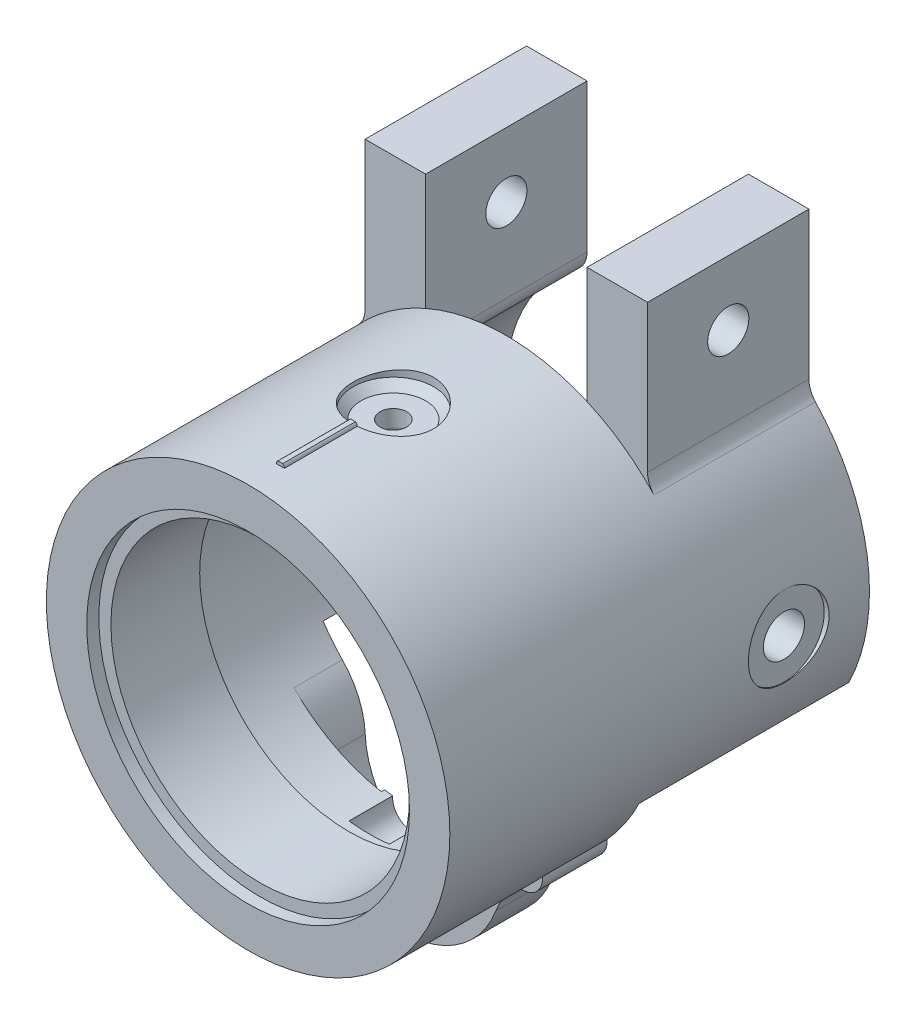
from build123d import *
from build123d.topology import SkipClean

# Parameters (mm, degrees)
SKETCH_1_R               = 25
SKETCH_1_R_2             = 18.5
EXTRUDE_1_DEPTH          = 11
SKETCH_2_R               = 25
SKETCH_2_R_2             = 20
EXTRUDE_2_DEPTH          = 1.5
EXTRUDE_START            = 1.5
SKETCH_3_R               = 25
SKETCH_3_R_2             = 20
EXTRUDE_3_DEPTH          = 1.5
SKETCH_4_R               = 0.5
EXTRUDE_4_DEPTH          = 10
EXTRUDE_START_2          = 4
SKETCH_6_R               = 22
EXTRUDE_5_DEPTH          = 4
SKETCH_7_R               = 2
CUT_EXTRUDE_1_DEPTH      = 4
F_1_ENCODERHOLDER_2_R    = 22
F_1_ENCODERHOLDER_2_R_2  = 18.5
F_1_ENCODERHOLDER_DEPTH  = 4
F_2_ENCODERHOLDER_START  = -4
F_2_ENCODERHOLDER_2_R    = 2
F_2_ENCODERHOLDER_DEPTH  = 4
F_3_ENCODERHOLDER_2_R    = 25
F_3_ENCODERHOLDER_2_R_2  = 18.5
F_3_ENCODERHOLDER_DEPTH  = 4
F_8_ENCODERHOLDER_R      = 2.5
CUT_EXTRUDE_6_DEPTH      = 10
SKETCH_9_R               = 12.5
CUT_EXTRUDE_7_DEPTH      = 2
F_5_ENCODERHOLDER_DEPTH  = 4
EXTRUDE_1_2_DEPTH        = 0.4
FILLET_1_R               = 1
SKETCH_12_R              = 0.9
CUT_EXTRUDE_8_DEPTH      = 10
EXTRUDE_2_2_DEPTH        = 6
FILLET_2_R               = 1
FILLET_START             = -1
FILLET_3_DEPTH           = 5
FILLET_START_2           = 0.675968
FILLET_3_2_DEPTH         = 5.324032
CUT_EXTRUDE_9_DEPTH      = 10
MOVE_BODY_2_ANGLE        = 180
SKETCH_15_R              = 20
CUT_EXTRUDE_10_DEPTH     = 79
EXTRUDE_12_DEPTH         = 4
CUT_EXTRUDE_11_DEPTH     = 3
EXTRUDE_13_DEPTH         = 10
EXTRUDE_14_DEPTH         = 1
SKETCH_22_R              = 1
CUT_EXTRUDE_12_DEPTH     = 8
SKETCH_23_R              = 2.5
SKETCH_23_R_2            = 1
EXTRUDE_16_DEPTH         = 8
SKETCH_24_W              = 1.265565874
SKETCH_24_H              = 0.2
CUT_EXTRUDE_13_DEPTH     = 25
EXTRUDE_5_2_DEPTH        = 6
FILLET_4_R               = 10
FILLET_5_R               = 10
FILLET_6_R               = 10
FILLET_7_R               = 10
SKETCH_26_R              = 1.65
CUT_EXTRUDE_14_DEPTH     = 36
SKETCH_27_R              = 5
CUT_EXTRUDE_15_DEPTH     = 2.4
FILLET_8_R               = 1
CHAMFER_2_SIZE           = 1
EXTRUDE_18_DEPTH         = 24
SKETCH_29_R              = 2.55
CUT_EXTRUDE_16_DEPTH     = 67
SKETCH_30_R              = 5
CUT_EXTRUDE_17_DEPTH     = 1
PATTERN_CIRCULAR_1_COUNT = 4
EXTRUDE_19_DEPTH         = 2
SKETCH_32_W              = 20
SKETCH_32_H              = 27.86164832
CUT_EXTRUDE_18_DEPTH     = 20
SKETCH_33_W              = 7.5
SKETCH_33_H              = 20
EXTRUDE_20_DEPTH         = 20
SKETCH_34_R              = 2.55
CUT_EXTRUDE_19_DEPTH     = 20
FILLET_9_R               = 3


with BuildPart() as part:
    # 草图1 → Extrude 1 (new body)
    with BuildSketch(Plane.XY):
        Circle(SKETCH_1_R)
        Circle(SKETCH_1_R_2, mode=Mode.SUBTRACT)
    extrude(amount=EXTRUDE_1_DEPTH)

    # 草图2 → Extrude 2 (add)
    with BuildSketch(Plane.XY.offset(11)):
        Circle(SKETCH_2_R)
        Circle(SKETCH_2_R_2, mode=Mode.SUBTRACT)
    extrude(amount=EXTRUDE_2_DEPTH)

    # 草图3 → 凸台-拉伸3 (add)
    with BuildSketch(Plane(origin=(0, 0, 0), x_dir=(-1, 0, 0), z_dir=(0, 0, -1)).offset(EXTRUDE_START)):
        Circle(SKETCH_3_R)
        with Locations(Location((0, 0, 0), (0, 0, 180))):
            Circle(SKETCH_3_R_2, mode=Mode.SUBTRACT)
    extrude(amount=-EXTRUDE_3_DEPTH)

    # 草图4 → 凸台-拉伸4 (add)
    with SkipClean():  # the faces are left unmerged after this step: merging them gives an invalid solid
        with BuildSketch(Plane(origin=(0, 0, -1.5), x_dir=(-1, 0, 0), z_dir=(0, 0, -1))):
            with Locations((0, 25)):
                Circle(SKETCH_4_R)
        extrude(amount=-EXTRUDE_4_DEPTH)

    # 草图6 → Extrude 5 (add)
    with SkipClean():  # the faces are left unmerged after this step: merging them gives an invalid solid
        with BuildSketch(Plane(origin=(0, 0, -1.5), x_dir=(-1, 0, 0), z_dir=(0, 0, -1)).offset(EXTRUDE_START_2)):
            with BuildLine():
                ThreePointArc((-0.499974999, 24.995), (0, -25), (0.499974999, 24.995))
                ThreePointArc((0.499974999, 24.995), (0, 25.5), (-0.499974999, 24.995))
            make_face()
            Circle(SKETCH_6_R, mode=Mode.SUBTRACT)
        extrude(amount=-EXTRUDE_5_DEPTH)

    # 草图7 → 切除-拉伸1 (cut)
    with SkipClean():  # the faces are left unmerged after this step: merging them gives an invalid solid
        with BuildSketch(Plane(origin=(0, 0, -5.5), x_dir=(-1, 0, 0), z_dir=(0, 0, -1))):
            with Locations((0, 22)):
                Circle(SKETCH_7_R)
        extrude(amount=-CUT_EXTRUDE_1_DEPTH, mode=Mode.SUBTRACT)


with BuildPart() as body_2:
    # 1_EncoderHolder 2 → 1_EncoderHolder (new body)
    with BuildSketch(Plane.XY):
        Circle(F_1_ENCODERHOLDER_2_R)
        Circle(F_1_ENCODERHOLDER_2_R_2, mode=Mode.SUBTRACT)
    extrude(amount=F_1_ENCODERHOLDER_DEPTH)

    # 2_EncoderHolder 2 → 2_EncoderHolder (add)
    with BuildSketch(Plane.XY.offset(4).offset(F_2_ENCODERHOLDER_START)):
        with Locations((0, 22)):
            Circle(F_2_ENCODERHOLDER_2_R)
    extrude(amount=F_2_ENCODERHOLDER_DEPTH)

    # 3_EncoderHolder 2 → 3_EncoderHolder (add)
    with BuildSketch(Plane.XY.offset(4)):
        with Locations(Location((0, 0, 0), (0, 0, 91.14593469))):
            Circle(F_3_ENCODERHOLDER_2_R)
        Circle(F_3_ENCODERHOLDER_2_R_2, mode=Mode.SUBTRACT)
    extrude(amount=F_3_ENCODERHOLDER_DEPTH)

    # 草图8_EncoderHolder → 切除-拉伸6 (cut)
    with BuildSketch(Plane(origin=(0, 0, 0), x_dir=(-1, 0, 0), z_dir=(0, 0, -1))):
        with Locations((0, -20)):
            Circle(F_8_ENCODERHOLDER_R)
    extrude(amount=-CUT_EXTRUDE_6_DEPTH, mode=Mode.SUBTRACT)

    # 草图9 → 切除-拉伸7 (cut)
    with BuildSketch(Plane.XY.offset(8)):
        with Locations((0, -20)):
            Circle(SKETCH_9_R)
    extrude(amount=-CUT_EXTRUDE_7_DEPTH, mode=Mode.SUBTRACT)

    # 草图10 → 5_EncoderHolder (add)
    with BuildSketch(Plane.XY.offset(8)):
        with BuildLine():
            ThreePointArc((-11.297234175, -14.65), (-12.35555427, -18.105196926), (-12.381272085, -21.71875))
            ThreePointArc((-12.381272085, -21.71875), (0, 25), (12.381272085, -21.71875))
            ThreePointArc((12.381272085, -21.71875), (12.35555427, -18.105196926), (11.297234175, -14.65))
            ThreePointArc((11.297234175, -14.65), (0, 18.5), (-11.297234175, -14.65))
        make_face()
    extrude(amount=F_5_ENCODERHOLDER_DEPTH)

    # 草图11 → Extrude 1 2 (add)
    with BuildSketch(Plane.XY.offset(6)):
        with BuildLine():
            ThreePointArc((-1.920937271, -18.4), (0, -22.5), (1.920937271, -18.4))
            Line((1.920937271, -18.4), (2.68931218, -17.76))
            ThreePointArc((2.68931218, -17.76), (0, -23.5), (-2.68931218, -17.76))
            Line((-2.68931218, -17.76), (-1.920937271, -18.4))
        make_face()
    extrude(amount=EXTRUDE_1_2_DEPTH)

    # 圆角1
    # the kernel refuses this fillet: 1 mm, written as the material it takes off along each edge
    with BuildSketch(Plane(origin=(2.68931218, -17.76, 6), x_dir=(-0.7683749084931953, -0.6399999999984951, 0), z_dir=(0, 0, 1))) as fillet_1_piece_1:
        with BuildLine():
            CenterArc((1.2, 0.979795897), FILLET_1_R, 156.926081935, 101.536959033)
            Line((0.28, 1.371714256), (0.2616, 1.379552623))
            ThreePointArc((0.2616, 1.379552623), (0.051118442, 0.704), (-0.02, 0))
            Line((-0.02, 0), (0, -0.02))
            ThreePointArc((0, -0.02), (0.5, -0.02), (0.996, -0.019595918))
            Line((0.996, -0.019595918), (1, 0))
        make_face()
    extrude(amount=3.9, mode=Mode.SUBTRACT)
    with BuildSketch(Plane(origin=(-2.68931218, -17.76, 6), x_dir=(0.7683749084932087, -0.6399999999984791, 0), z_dir=(0, 0, 1))) as fillet_1_piece_2:
        with BuildLine():
            CenterArc((1.2, -0.979795897), FILLET_1_R, 101.536959033, 101.536959033)
            Line((0.28, -1.371714256), (0.2616, -1.379552623))
            ThreePointArc((0.2616, -1.379552623), (0.051118442, -0.704), (-0.02, 0))
            Line((-0.02, 0), (0, 0.02))
            ThreePointArc((0, 0.02), (0.5, 0.02), (0.996, 0.019595918))
            Line((0.996, 0.019595918), (1, 0))
        make_face()
    extrude(amount=3.9, mode=Mode.SUBTRACT)

    # 草图12 → 切除-拉伸8 (cut)
    with BuildSketch(Plane.XY.offset(12)):
        with Locations((-17.320508076, -10)):
            Circle(SKETCH_12_R)
        with Locations((17.320508076, -10)):
            Circle(SKETCH_12_R)
    extrude(amount=-CUT_EXTRUDE_8_DEPTH, mode=Mode.SUBTRACT)

    # 草图13 → Extrude 2 2 (add)
    with BuildSketch(Plane(origin=(0, 0, 0), x_dir=(-1, 0, 0), z_dir=(0, 0, -1))):
        Polygon((0, 18.5), (-7.664854858, 8), (-8.472547166, 8.58960422), (-0.807692308, 19.08960422), align=None)
    extrude(amount=-EXTRUDE_2_2_DEPTH)

    # 圆角2
    fillet_2_edges = [body_2.edges().sort_by_distance(p)[0] for p in [
        (1.269951879, 18.45635994, 3),
    ]]
    fillet(fillet_2_edges, radius=FILLET_2_R)

    # 圆角3: read off the stored shape, not the designer's step
    # 圆角3 outline → 圆角3 (cut)
    with BuildSketch(Plane.XY.offset(FILLET_START)):
        with BuildLine():
            ThreePointArc((-3.232609366, -18.215384615), (-2.572131012, -18.65007493), (-2.433817862, -19.428571429))
            ThreePointArc((-2.433817862, -19.428571429), (-2.237289178, -18.884411754), (-1.920937271, -18.4))
            ThreePointArc((-1.920937271, -18.4), (-2.578426157, -18.319435541), (-3.232609366, -18.215384615))
        make_face()
        with BuildLine():
            ThreePointArc((-1.572207346, -21.94375), (-2.132936973, -21.304062832), (-2.446717755, -20.513392857))
            ThreePointArc((-2.446717755, -20.513392857), (-2.703266107, -21.410498238), (-3.588519374, -21.705357143))
            ThreePointArc((-3.588519374, -21.705357143), (-2.583114953, -21.847826371), (-1.572207346, -21.94375))
        make_face()
        with BuildLine():
            ThreePointArc((2.433817862, -19.428571429), (2.572131012, -18.65007493), (3.232609366, -18.215384615))
            ThreePointArc((3.232609366, -18.215384615), (2.578426157, -18.319435541), (1.920937271, -18.4))
            ThreePointArc((1.920937271, -18.4), (2.237289178, -18.884411754), (2.433817862, -19.428571429))
        make_face()
        with BuildLine():
            ThreePointArc((2.446717755, -20.513392857), (2.132936973, -21.304062832), (1.572207346, -21.94375))
            ThreePointArc((1.572207346, -21.94375), (2.583114953, -21.847826371), (3.588519374, -21.705357143))
            ThreePointArc((3.588519374, -21.705357143), (2.703266107, -21.410498238), (2.446717755, -20.513392857))
        make_face()
    extrude(amount=FILLET_3_DEPTH, mode=Mode.SUBTRACT)

    # Fillet 3 2 outline → Fillet 3 2 (cut)
    with BuildSketch(Plane.XY.offset(FILLET_START_2)):
        with BuildLine():
            ThreePointArc((-3.232609366, -18.215384615), (-2.572131012, -18.65007493), (-2.433817862, -19.428571429))
            ThreePointArc((-2.433817862, -19.428571429), (-2.237289178, -18.884411754), (-1.920937271, -18.4))
            ThreePointArc((-1.920937271, -18.4), (-2.578426157, -18.319435541), (-3.232609366, -18.215384615))
        make_face()
        with BuildLine():
            ThreePointArc((2.433817862, -19.428571429), (2.572131012, -18.65007493), (3.232609366, -18.215384615))
            ThreePointArc((3.232609366, -18.215384615), (2.578426157, -18.319435541), (1.920937271, -18.4))
            ThreePointArc((1.920937271, -18.4), (2.237289178, -18.884411754), (2.433817862, -19.428571429))
        make_face()
    extrude(amount=FILLET_3_2_DEPTH, mode=Mode.SUBTRACT)

    # 草图14 → 切除-拉伸9 (cut)
    with BuildSketch(Plane(origin=(0, 0, 6), x_dir=(-1, 0, 0), z_dir=(0, 0, -1))):
        with BuildLine():
            ThreePointArc((-1.920937271, -18.4), (-2.374439978, -18.281048442), (-2.832315159, -18.38186757))
            ThreePointArc((-2.832315159, -18.38186757), (-2.472783917, -18.844197291), (-2.433817862, -19.428571429))
            ThreePointArc((-2.433817862, -19.428571429), (-2.237289178, -18.884411754), (-1.920937271, -18.4))
        make_face()
        with BuildLine():
            ThreePointArc((2.832315159, -18.38186757), (2.374439978, -18.281048442), (1.920937271, -18.4))
            ThreePointArc((1.920937271, -18.4), (2.237289178, -18.884411754), (2.433817862, -19.428571429))
            ThreePointArc((2.433817862, -19.428571429), (2.472783917, -18.844197291), (2.832315159, -18.38186757))
        make_face()
    extrude(amount=-CUT_EXTRUDE_9_DEPTH, mode=Mode.SUBTRACT)


with BuildPart() as body_2_1:
    # Move Body 1: moved
    add(body_2.part.moved(Location((-19.686751507, 39.513113702, 20.464284415))))


with BuildPart() as body_2_2:
    # Move Body 2: read off the stored shape, not the designer's step
    # Move Body 2: moved
    add(body_2_1.part.moved(Location((19.6867515, -39.5131137, -18.9642844))).rotate(Axis((0, 0, 0), (0, 1, 0)), MOVE_BODY_2_ANGLE))

    # Combine 1: union part
    add(part.part)

    # 草图15 → 切除-拉伸10 (cut)
    with BuildSketch(Plane(origin=(0, 0, 0), x_dir=(-1, 0, 0), z_dir=(0, 0, -1))):
        with Locations(Location((0, 0, 0), (0, 0, 180))):
            Circle(SKETCH_15_R)
    extrude(amount=CUT_EXTRUDE_10_DEPTH, mode=Mode.SUBTRACT)

    # 草图16 → 凸台-拉伸12 (add)
    with BuildSketch(Plane(origin=(0, 0, -1.5), x_dir=(-1, 0, 0), z_dir=(0, 0, -1))):
        with BuildLine():
            ThreePointArc((-2.49511241, -19.84375), (-2.493496889, -20.180203401), (-2.446717755, -20.513392857))
            ThreePointArc((-2.446717755, -20.513392857), (-2.703266107, -21.410498238), (-3.588519374, -21.705357143))
            ThreePointArc((-3.588519374, -21.705357143), (0, -22), (3.588519374, -21.705357143))
            ThreePointArc((3.588519374, -21.705357143), (2.703266107, -21.410498238), (2.446717755, -20.513392857))
            ThreePointArc((2.446717755, -20.513392857), (2.493496889, -20.180203401), (2.49511241, -19.84375))
            ThreePointArc((2.49511241, -19.84375), (0, -20), (-2.49511241, -19.84375))
        make_face()
    extrude(amount=EXTRUDE_12_DEPTH)

    # 草图17 → 切除-拉伸11 (cut)
    with BuildSketch(Plane(origin=(0, 0, -5.5), x_dir=(-1, 0, 0), z_dir=(0, 0, -1))):
        with BuildLine():
            ThreePointArc((-2.49511241, -19.84375), (0, -22.5), (2.49511241, -19.84375))
            ThreePointArc((2.49511241, -19.84375), (0, -20), (-2.49511241, -19.84375))
        make_face()
    extrude(amount=-CUT_EXTRUDE_11_DEPTH, mode=Mode.SUBTRACT)

    # 草图19 → 凸台-拉伸13 (add)
    with BuildSketch(Plane(origin=(0, 0, -3.5), x_dir=(-1, 0, 0), z_dir=(0, 0, -1))):
        with BuildLine():
            ThreePointArc((16.853084982, -10.769100547), (18.099930939, -10.45), (17.752857141, -9.210649453))
            ThreePointArc((17.752857141, -9.210649453), (17.320508076, -10), (16.853084982, -10.769100547))
        make_face()
        with BuildLine():
            ThreePointArc((-17.752857141, -9.210649453), (-18.099930939, -10.45), (-16.853084982, -10.769100547))
            ThreePointArc((-16.853084982, -10.769100547), (-17.320508076, -10), (-17.752857141, -9.210649453))
        make_face()
    extrude(amount=EXTRUDE_13_DEPTH)

    # 草图20 → 凸台-拉伸14 (add)
    with BuildSketch(Plane(origin=(0, 0, -7.5), x_dir=(-1, 0, 0), z_dir=(0, 0, -1))):
        with BuildLine():
            ThreePointArc((-12.381272085, -21.71875), (0, -32.5), (12.381272085, -21.71875))
            ThreePointArc((12.381272085, -21.71875), (0, -25), (-12.381272085, -21.71875))
        make_face()
    extrude(amount=-EXTRUDE_14_DEPTH)

    # 草图22 → 切除-拉伸12 (cut)
    with BuildSketch(Plane(origin=(0, 0, -13.5), x_dir=(-1, 0, 0), z_dir=(0, 0, -1))):
        with Locations((-16, -17)):
            Circle(SKETCH_22_R)
    cut_extrude_12 = extrude(amount=-CUT_EXTRUDE_12_DEPTH, mode=Mode.SUBTRACT)

    # 草图23 → 凸台-拉伸16 (add)
    with BuildSketch(Plane(origin=(0, 0, -13.5), x_dir=(-1, 0, 0), z_dir=(0, 0, -1))):
        with Locations((-16, -17)):
            Circle(SKETCH_23_R)
        with Locations((-16, -17)):
            Circle(SKETCH_23_R_2, mode=Mode.SUBTRACT)
    extrude_16 = extrude(amount=-EXTRUDE_16_DEPTH)

    # 镜向2: 切除-拉伸12, 凸台-拉伸16 across plane
    add(cut_extrude_12.mirror(Plane(origin=(0, 0, 0), x_dir=(0, 0, 1), z_dir=(1, 0, 0))), mode=Mode.SUBTRACT)
    add(extrude_16.mirror(Plane(origin=(0, 0, 0), x_dir=(0, 0, 1), z_dir=(1, 0, 0))))

    # 草图24 → 切除-拉伸13 (cut)
    with BuildSketch(Plane(origin=(0, 0, -13.5), x_dir=(-1, 0, 0), z_dir=(0, 0, -1))):
        with Locations((0, 25.5)):
            Rectangle(SKETCH_24_W, SKETCH_24_H)
    extrude(amount=-CUT_EXTRUDE_13_DEPTH, mode=Mode.SUBTRACT)

    # 草图25 → Extrude 5 2 (add)
    with BuildSketch(Plane(origin=(0, 0, -7.5), x_dir=(-1, 0, 0), z_dir=(0, 0, -1))):
        with BuildLine():
            ThreePointArc((-11.873971995, -16.09375), (-12.449472784, -18.877223349), (-12.381272085, -21.71875))
            ThreePointArc((-12.381272085, -21.71875), (0, -32.5), (12.381272085, -21.71875))
            ThreePointArc((12.381272085, -21.71875), (12.449472784, -18.877223349), (11.873971995, -16.09375))
            Line((11.873971995, -16.09375), (10.924054235, -16.40625))
            ThreePointArc((10.924054235, -16.40625), (11.453514961, -18.967045481), (11.390770318, -21.58125))
            ThreePointArc((11.390770318, -21.58125), (0, -31.5), (-11.390770318, -21.58125))
            ThreePointArc((-11.390770318, -21.58125), (-11.453514961, -18.967045481), (-10.924054235, -16.40625))
            Line((-10.924054235, -16.40625), (-11.873971995, -16.09375))
        make_face()
    extrude(amount=EXTRUDE_5_2_DEPTH)

    # 圆角4
    # the kernel refuses this fillet: 10 mm, written as the material it takes off along each edge
    with BuildSketch(Plane(origin=(10.924054235, -16.40625, -7.5), x_dir=(0.9499177588002072, 0.312500002425586, 0), z_dir=(0, 0, -1))) as fillet_4_piece_1:
        with BuildLine():
            CenterArc((9.239999982, 5.665898025), FILLET_4_R, 195.279631881, 19.233131139)
            ThreePointArc((-0.406511638, 3.030596604), (-0.102080978, 1.528869475), (0, 0))
            Line((0, 0), (1.000000008, 0))
        make_face()
    extrude(amount=13.644347377, mode=Mode.SUBTRACT)
    with BuildSketch(Plane(origin=(-10.924054235, -16.40625, -7.5), x_dir=(-0.9499177602580843, 0.31249999799402367, 0), z_dir=(0, 0, -1))) as fillet_4_piece_2:
        with BuildLine():
            CenterArc((9.240000015, -5.665897956), FILLET_4_R, 145.487237464, 19.233130995)
            ThreePointArc((-0.40651162, -3.030596592), (-0.10208097, -1.528869468), (0, 0))
            Line((0, 0), (0.999999994, 0))
        make_face()
    extrude(amount=13.64434734, mode=Mode.SUBTRACT)

    # 圆角5
    # the kernel refuses this fillet: 10 mm, written as the material it takes off along each edge
    with BuildSketch(Plane(origin=(-11.87397199, -16.093750004, -24.569552782), x_dir=(-0.7538894395280353, 0.6570013036274012, 0), z_dir=(0, 0, 1))) as fillet_5_piece_1:
        with BuildLine():
            CenterArc((4.054881612, 9.967061623), FILLET_5_R, 223.587400745, 41.760938805)
            Line((-3.18835329, 3.072458796), (-3.912676781, 2.382998513))
            ThreePointArc((-3.912676781, 2.382998513), (-3.259922176, 1.628489204), (-0.539147437, -0.842211399))
            Line((-0.539147437, -0.842211399), (0.081097632, -0.996706162))
            ThreePointArc((0.081097632, -0.996706162), (1.621952645, -0.934123247), (3.162807657, -0.996706162))
            Line((3.162807657, -0.996706162), (3.243905289, 0))
        make_face()
    extrude(amount=17.069552767, mode=Mode.SUBTRACT)

    # 圆角6
    # the kernel refuses this fillet: 10 mm, written as the material it takes off along each edge
    with BuildSketch(Plane(origin=(11.873972002, -16.093749995, -7.500000015), x_dir=(0.7538894392828103, 0.6570013039087899, 0), z_dir=(0, 0, -1))) as fillet_6_piece_1:
        with BuildLine():
            CenterArc((4.054881593, 9.967061624), FILLET_6_R, 223.587400767, 41.760938805)
            Line((-3.188353306, 3.072458793), (-3.912676796, 2.38299851))
            ThreePointArc((-3.912676796, 2.38299851), (-3.2599222, 1.628489213), (-0.539147434, -0.842211401))
            Line((-0.539147434, -0.842211401), (0.081097632, -0.996706162))
            ThreePointArc((0.081097632, -0.996706162), (1.621952637, -0.934123247), (3.162807643, -0.996706162))
            Line((3.162807643, -0.996706162), (3.243905275, 0))
        make_face()
    extrude(amount=17.069552792, mode=Mode.SUBTRACT)

    # 圆角7
    fillet_7_edges = [body_2_2.edges().sort_by_distance(p)[0] for p in [
        (-12.381272077, -21.718749998, -10.500000015),
        (12.38127209, -21.718749998, -10.500000011),
    ]]
    fillet(fillet_7_edges, radius=FILLET_7_R)

    # 草图26 → 切除-拉伸14 (cut)
    with BuildSketch(Plane(origin=(0, 0, 0), x_dir=(1, 0, 0), z_dir=(0, 1, 0))):
        with Locations(Location((0, 5.5, 0), (0, 0, 90))):
            Circle(SKETCH_26_R)
    extrude(amount=CUT_EXTRUDE_14_DEPTH, mode=Mode.SUBTRACT)

    # 草图27 → 切除-拉伸15 (cut)
    with BuildSketch(Plane(origin=(0, 25.4, 0), x_dir=(1, 0, 0), z_dir=(0, 1, 0))):
        with Locations(Location((0, 5.5, 0), (0, 0, 270))):
            Circle(SKETCH_27_R)
    extrude(amount=-CUT_EXTRUDE_15_DEPTH, mode=Mode.SUBTRACT)

    # 圆角8
    fillet_8_edges = [body_2_2.edges().sort_by_distance(p)[0] for p in [
        (-6e-09, 20.000000028, -3.84999999),
    ]]
    fillet(fillet_8_edges, radius=FILLET_8_R)

    # 倒角2
    chamfer_2_edges = [body_2_2.edges().sort_by_distance(p)[0] for p in [
        (0, 23, -10.5),
    ]]
    chamfer(chamfer_2_edges, length=CHAMFER_2_SIZE)

    # 草图28 → 凸台-拉伸18 (add)
    with BuildSketch(Plane(origin=(0, 0, -13.5), x_dir=(-1, 0, 0), z_dir=(0, 0, -1))):
        with BuildLine():
            Line((-22.449944321, -11), (-16.703293088, -11))
            ThreePointArc((-16.703293088, -11), (0, 20), (16.703293088, -11))
            Line((16.703293088, -11), (22.449944321, -11))
            ThreePointArc((22.449944321, -11), (0, 25), (-22.449944321, -11))
        make_face()
    extrude(amount=EXTRUDE_18_DEPTH)

    # 草图29 → 切除-拉伸16 (cut)
    with BuildSketch(Plane(origin=(0, 0, 0), x_dir=(1, 0, 0), z_dir=(0, 1, 0))):
        with Locations(Location((0, 29.5, 0), (0, 0, 90))):
            Circle(SKETCH_29_R)
    cut_extrude_16 = extrude(amount=CUT_EXTRUDE_16_DEPTH, mode=Mode.SUBTRACT)

    # 草图30 → 切除-拉伸17 (cut)
    with BuildSketch(Plane(origin=(0, 25.4, 0), x_dir=(1, 0, 0), z_dir=(0, 1, 0))):
        with Locations(Location((0, 29.5, 0), (0, 0, 270))):
            Circle(SKETCH_30_R)
    cut_extrude_17 = extrude(amount=-CUT_EXTRUDE_17_DEPTH, mode=Mode.SUBTRACT)

    # 阵列(圆周)1: 切除-拉伸16, 切除-拉伸17 ×4 about axis
    pattern_circular_1_axis = Axis((0, 0, 0), (0, 0, 1))
    add([cut_extrude_16.rotate(pattern_circular_1_axis, i * 360 / PATTERN_CIRCULAR_1_COUNT) for i in range(1, PATTERN_CIRCULAR_1_COUNT)], mode=Mode.SUBTRACT)
    add([cut_extrude_17.rotate(pattern_circular_1_axis, i * 360 / PATTERN_CIRCULAR_1_COUNT) for i in range(1, PATTERN_CIRCULAR_1_COUNT)], mode=Mode.SUBTRACT)

    # 草图31 → 凸台-拉伸19 (add)
    with BuildSketch(Plane(origin=(0, 0, -37.5), x_dir=(-1, 0, 0), z_dir=(0, 0, -1))):
        with BuildLine():
            Line((-22.449944321, -11), (-16.703293088, -11))
            ThreePointArc((-16.703293088, -11), (0, 20), (16.703293088, -11))
            Line((16.703293088, -11), (22.449944321, -11))
            ThreePointArc((22.449944321, -11), (0, 25), (-22.449944321, -11))
        make_face()
    extrude(amount=EXTRUDE_19_DEPTH)

    # 草图32 → 切除-拉伸18 (cut)
    with BuildSketch(Plane(origin=(0, 0, -39.5), x_dir=(-1, 0, 0), z_dir=(0, 0, -1))):
        with Locations((0, 20)):
            Rectangle(SKETCH_32_W, SKETCH_32_H)
    extrude(amount=-CUT_EXTRUDE_18_DEPTH, mode=Mode.SUBTRACT)

    # 草图33 → 凸台-拉伸20 (add)
    with BuildSketch(Plane(origin=(0, 0, -19.5), x_dir=(-1, 0, 0), z_dir=(0, 0, -1))):
        with Locations((13.75, 27.320508076)):
            Rectangle(SKETCH_33_W, SKETCH_33_H)
    extrude_20 = extrude(amount=EXTRUDE_20_DEPTH)

    # 草图34 → 切除-拉伸19 (cut)
    with BuildSketch(Plane.ZY.offset(17.5)):
        with Locations((-29.5, 29.320508076)):
            Circle(SKETCH_34_R)
    cut_extrude_19 = extrude(amount=-CUT_EXTRUDE_19_DEPTH, mode=Mode.SUBTRACT)

    # 镜向3: 凸台-拉伸20, 切除-拉伸19 across plane
    add(extrude_20.mirror(Plane(origin=(0, 0, 0), x_dir=(0, 0, 1), z_dir=(1, 0, 0))))
    add(cut_extrude_19.mirror(Plane(origin=(0, 0, 0), x_dir=(0, 0, 1), z_dir=(1, 0, 0))), mode=Mode.SUBTRACT)

    # 圆角9
    fillet_9_edges = [body_2_2.edges().sort_by_distance(p)[0] for p in [
        (-10, 17.320508076, -28.5),
        (10, 17.320508076, -28.5),
        (-17.5, 17.853571071, -28.5),
        (17.5, 17.853571071, -28.5),
    ]]
    fillet(fillet_9_edges, radius=FILLET_9_R)


solid = body_2_2.part
